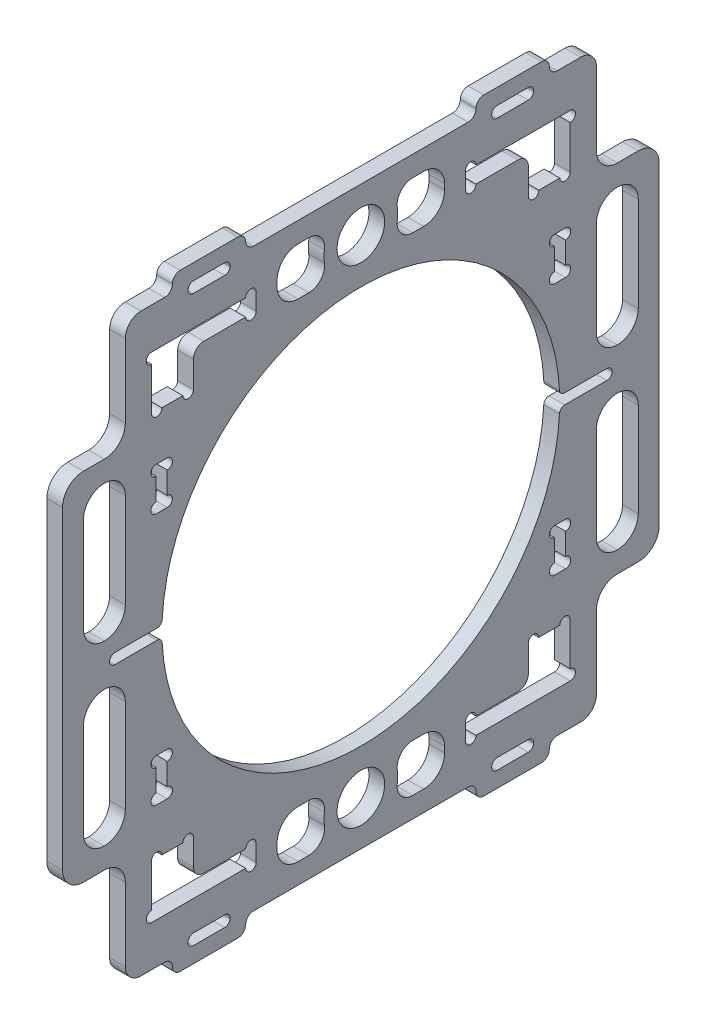
from build123d import *

# Parameters (mm, degrees)
SKETCH_1_W                = 90
SKETCH_1_H                = 110
SKETCH_1_R                = 38
EXTRUDE_1_DEPTH           = 3
FILLET_1_R                = 3
CUT_EXTRUDE_2_DEPTH       = 10
MIRROR_2_COPY_1_DEPTH     = 10
SKETCH_5_W                = 2.1
SKETCH_5_H                = 8.2
CUT_EXTRUDE_3_DEPTH       = 6
MIRROR_4_COPY_1_SKETCH_W  = 2.1
MIRROR_4_COPY_1_SKETCH_H  = 8.2
MIRROR_4_COPY_1_DEPTH     = 6
FILLET_2_R                = 2
SKETCH_6_W                = 32
SKETCH_6_H                = 9.1
CUT_EXTRUDE_4_DEPTH       = 10
FILLET_3_R                = 4
FILLET_3_OF_MIRROR_5_R    = 4
EXTRUDE_2_DEPTH           = 3
FILLET_5_R                = 4
SKETCH_10_R               = 7.05
SKETCH_10_R_2             = 4.55
EXTRUDE_3_DEPTH           = 3
FILLET_6_R                = 3
SKETCH_11_W               = 8
SKETCH_11_H               = 2.1
CUT_EXTRUDE_7_DEPTH       = 10
SKETCH_12_W               = 14
SKETCH_12_H               = 3
EXTRUDE_4_DEPTH           = 3
FILLET_7_R                = 1
FILLET_7_OF_MIRROR_12_R   = 1
MIRROR_13_DEPTH           = 3
MIRROR_13_2_OUTLINE_W     = 3
MIRROR_13_2_OUTLINE_H     = 14
MIRROR_13_2_DEPTH         = 3
FILLET_START              = -1
FILLET_8_DEPTH            = 5
FILLET_8_2_DEPTH          = 3
SKETCH_13_R               = 1
CUT_EXTRUDE_8_DEPTH       = 10
MIRROR_15_COPY_1_SKETCH_R = 1
MIRROR_15_COPY_1_DEPTH    = 10
SKETCH_14_W               = 17.279749577
SKETCH_14_H               = 8
EXTRUDE_5_DEPTH           = 3
FILLET_9_R                = 4
SKETCH_16_W               = 96
SKETCH_16_H               = 2
CUT_EXTRUDE_9_DEPTH       = 3
FILLET_10_R               = 1


with BuildPart() as part:
    # 草图1 → 凸台-拉伸1 (new body)
    with BuildSketch(Plane(origin=(0, 0, 0), x_dir=(0, 0, -1), z_dir=(1, 0, 0))):
        Rectangle(SKETCH_1_W, SKETCH_1_H)
        Circle(SKETCH_1_R, mode=Mode.SUBTRACT)
    extrude(amount=EXTRUDE_1_DEPTH)

    # 圆角1
    fillet_1_edges = [part.edges().sort_by_distance(p)[0] for p in [
        (1.5, 55, 45),
        (1.5, 55, -45),
        (1.5, -55, -45),
        (1.5, -55, 45),
    ]]
    fillet(fillet_1_edges, radius=FILLET_1_R)

    # 草图4 → 切除-拉伸2 (cut)
    with BuildSketch(Plane.ZY):
        Polygon((-32, -44), (-20, -44), (-20, -47.2), (-40, -47.2), (-40, -44), (-40, -37), (-32, -37), align=None)
    cut_extrude_2 = extrude(amount=-CUT_EXTRUDE_2_DEPTH, mode=Mode.SUBTRACT)

    # 镜向1: 切除-拉伸2 across plane
    add(cut_extrude_2.mirror(Plane.XY), mode=Mode.SUBTRACT)

    # 镜向2: 切除-拉伸2 across plane
    add(cut_extrude_2.mirror(Plane.ZX), mode=Mode.SUBTRACT)

    # 镜向2 copy 1 sketch → 镜向2 copy 1 (cut)
    with BuildSketch(Plane(origin=(0, 0, 0), x_dir=(0, 0, -1), z_dir=(-1, 0, 0))):
        Polygon((-32, -44), (-20, -44), (-20, -47.2), (-40, -47.2), (-40, -44), (-40, -37), (-32, -37), align=None)
    extrude(amount=-MIRROR_2_COPY_1_DEPTH, mode=Mode.SUBTRACT)

    # 草图5 → 切除-拉伸3 (cut)
    with BuildSketch(Plane.ZY):
        with Locations((-38.05, 24.1)):
            Rectangle(SKETCH_5_W, SKETCH_5_H)
    cut_extrude_3 = extrude(amount=-CUT_EXTRUDE_3_DEPTH, mode=Mode.SUBTRACT)

    # 镜向3: 切除-拉伸3 across plane
    add(cut_extrude_3.mirror(Plane.ZX), mode=Mode.SUBTRACT)

    # 镜向4: 切除-拉伸3 across plane
    add(cut_extrude_3.mirror(Plane.XY), mode=Mode.SUBTRACT)

    # 镜向4 copy 1 sketch → 镜向4 copy 1 (cut)
    with BuildSketch(Plane(origin=(0, 0, 0), x_dir=(0, 0, -1), z_dir=(-1, 0, 0))):
        with Locations((-38.05, 24.1)):
            Rectangle(MIRROR_4_COPY_1_SKETCH_W, MIRROR_4_COPY_1_SKETCH_H)
    extrude(amount=-MIRROR_4_COPY_1_DEPTH, mode=Mode.SUBTRACT)

    # 圆角2
    fillet_2_edges = [part.edges().sort_by_distance(p)[0] for p in [
        (1.5, 44, -32),
        (1.5, 44, 32),
        (1.5, -44, -32),
        (1.5, -44, 32),
    ]]
    fillet(fillet_2_edges, radius=FILLET_2_R)

    # 草图6 → 切除-拉伸4 (cut)
    with BuildSketch(Plane.ZY):
        with Locations((0, 46.55)):
            Rectangle(SKETCH_6_W, SKETCH_6_H)
    cut_extrude_4 = extrude(amount=-CUT_EXTRUDE_4_DEPTH, mode=Mode.SUBTRACT)

    # 圆角3
    fillet_3_edges = [part.edges().sort_by_distance(p)[0] for p in [
        (1.5, 51.1, 16),
        (1.5, 42, 16),
        (1.5, 42, -16),
        (1.5, 51.1, -16),
    ]]
    fillet(fillet_3_edges, radius=FILLET_3_R)

    # 镜向5: 切除-拉伸4 across plane
    add(cut_extrude_4.mirror(Plane.ZX), mode=Mode.SUBTRACT)

    # 圆角3 of 镜向5
    fillet_3_of_mirror_5_edges = [part.edges().sort_by_distance(p)[0] for p in [
        (1.5, -51.1, 16),
        (1.5, -42, 16),
        (1.5, -42, -16),
        (1.5, -51.1, -16),
    ]]
    fillet(fillet_3_of_mirror_5_edges, radius=FILLET_3_OF_MIRROR_5_R)

    # 草图9 → 凸台-拉伸2 (add)
    with BuildSketch(Plane.ZY):
        Polygon((53, 30), (53, -30), (45, -30), (45, -34), (57, -34), (57, 34), (45, 34), (45, 30), align=None)
    extrude_2 = extrude(amount=-EXTRUDE_2_DEPTH)

    # 镜向9: 凸台-拉伸2 across plane
    add(extrude_2.mirror(Plane.XY))

    # 圆角5
    fillet_5_edges = [part.edges().sort_by_distance(p)[0] for p in [
        (1.5, 34, 45),
        (1.5, 30, 45),
        (1.5, 30, 53),
        (1.5, 34, 57),
        (1.5, -34, 57),
        (1.5, -30, 53),
        (1.5, -30, 45),
        (1.5, -34, 45),
        (1.5, -34, -57),
        (1.5, 34, -57),
        (1.5, 30, -53),
        (1.5, -30, -53),
        (1.5, 30, -45),
        (1.5, -30, -45),
        (1.5, -34, -45),
        (1.5, 34, -45),
    ]]
    fillet(fillet_5_edges, radius=FILLET_5_R - 0.0001)  # a hair under: the kernel refuses the full size

    # 草图10 → 凸台-拉伸3 (add)
    with BuildSketch(Plane(origin=(3, 0, 0), x_dir=(0, 0, -1), z_dir=(1, 0, 0))):
        with Locations((0, 46.55)):
            Circle(SKETCH_10_R)
        with Locations((0, 46.55)):
            Circle(SKETCH_10_R_2, mode=Mode.SUBTRACT)
    extrude_3 = extrude(amount=-EXTRUDE_3_DEPTH)

    # 镜向11: 凸台-拉伸3 across plane
    add(extrude_3.mirror(Plane.ZX))

    # 圆角6
    fillet_6_edges = [part.edges().sort_by_distance(p)[0] for p in [
        (1.5, 51.1, -5.385164807),
        (1.5, 51.1, 5.385164807),
        (1.5, 42, -5.385164807),
        (1.5, 42, 5.385164807),
        (1.5, -42, 5.385164807),
        (1.5, -42, -5.385164807),
        (1.5, -51.1, 5.385164807),
        (1.5, -51.1, -5.385164807),
    ]]
    fillet(fillet_6_edges, radius=FILLET_6_R)

    # 草图11 → 切除-拉伸7 (cut)
    with BuildSketch(Plane(origin=(3, 0, 0), x_dir=(0, 0, -1), z_dir=(1, 0, 0))):
        with Locations((-29, -53.95)):
            Rectangle(SKETCH_11_W, SKETCH_11_H)
    cut_extrude_7 = extrude(amount=-CUT_EXTRUDE_7_DEPTH, mode=Mode.SUBTRACT)

    # 草图12 → 凸台-拉伸4 (add)
    with BuildSketch(Plane(origin=(3, 0, 0), x_dir=(0, 0, -1), z_dir=(1, 0, 0))):
        with Locations((-29, -56.5)):
            Rectangle(SKETCH_12_W, SKETCH_12_H)
    extrude_4 = extrude(amount=-EXTRUDE_4_DEPTH)

    # 圆角7
    fillet_7_edges = [part.edges().sort_by_distance(p)[0] for p in [
        (1.5, -55, 25),
        (1.5, -55, 33),
        (1.5, -52.9, 33),
        (1.5, -52.9, 25),
    ]]
    fillet(fillet_7_edges, radius=FILLET_7_R)

    # 镜向12: 切除-拉伸7, 凸台-拉伸4 across plane
    add(cut_extrude_7.mirror(Plane.ZX), mode=Mode.SUBTRACT)
    add(extrude_4.mirror(Plane.ZX))

    # 圆角7 of 镜向12
    fillet_7_of_mirror_12_edges = [part.edges().sort_by_distance(p)[0] for p in [
        (1.5, 55, 25),
        (1.5, 55, 33),
        (1.5, 52.9, 33),
        (1.5, 52.9, 25),
    ]]
    fillet(fillet_7_of_mirror_12_edges, radius=FILLET_7_OF_MIRROR_12_R)

    # 镜向13: read off the stored shape, not the designer's step
    # 镜向13 outline → 镜向13 (cut)
    with BuildSketch(Plane.YZ):
        with BuildLine():
            Line((-52.9, -32), (-52.9, -26))
            ThreePointArc((-52.9, -26), (-53.192893219, -25.292893219), (-53.9, -25))
            Line((-53.9, -25), (-54, -25))
            ThreePointArc((-54, -25), (-54.707106781, -25.292893219), (-55, -26))
            Line((-55, -26), (-55, -32))
            ThreePointArc((-55, -32), (-54.707106781, -32.707106781), (-54, -33))
            Line((-54, -33), (-53.9, -33))
            ThreePointArc((-53.9, -33), (-53.192893219, -32.707106781), (-52.9, -32))
        make_face()
        with BuildLine():
            ThreePointArc((53.9, -25), (53.192893219, -25.292893219), (52.9, -26))
            Line((52.9, -26), (52.9, -32))
            ThreePointArc((52.9, -32), (53.192893219, -32.707106781), (53.9, -33))
            Line((53.9, -33), (54, -33))
            ThreePointArc((54, -33), (54.707106781, -32.707106781), (55, -32))
            Line((55, -32), (55, -26))
            ThreePointArc((55, -26), (54.707106781, -25.292893219), (54, -25))
            Line((54, -25), (53.9, -25))
        make_face()
    extrude(amount=MIRROR_13_DEPTH, mode=Mode.SUBTRACT)

    # Mirror 13 2 outline → Mirror 13 2 (add)
    with BuildSketch(Plane.YZ):
        with Locations((-56.5, -29)):
            Rectangle(MIRROR_13_2_OUTLINE_W, MIRROR_13_2_OUTLINE_H)
        with Locations((56.5, -29)):
            Rectangle(MIRROR_13_2_OUTLINE_W, MIRROR_13_2_OUTLINE_H)
    extrude(amount=MIRROR_13_2_DEPTH)

    # 圆角8: read off the stored shape, not the designer's step
    # 圆角8 outline → 圆角8 (cut)
    with BuildSketch(Plane.YZ.offset(FILLET_START)):
        with BuildLine():
            ThreePointArc((56.5, 36), (57.560660172, 35.560660172), (58, 34.5))
            Line((58, 34.5), (58, 36))
            Line((58, 36), (56.5, 36))
        make_face()
        with BuildLine():
            Line((58, -36), (58, -34.5))
            ThreePointArc((58, -34.5), (57.560660172, -35.560660172), (56.5, -36))
            Line((56.5, -36), (58, -36))
        make_face()
        with BuildLine():
            Line((58, -22), (56.5, -22))
            ThreePointArc((56.5, -22), (57.560660172, -22.439339828), (58, -23.5))
            Line((58, -23.5), (58, -22))
        make_face()
        with BuildLine():
            Line((58, 22), (58, 23.5))
            ThreePointArc((58, 23.5), (57.560660172, 22.439339828), (56.5, 22))
            Line((56.5, 22), (58, 22))
        make_face()
        with BuildLine():
            ThreePointArc((-56.5, -36), (-57.560660172, -35.560660172), (-58, -34.5))
            Line((-58, -34.5), (-58, -36))
            Line((-58, -36), (-56.5, -36))
        make_face()
        with BuildLine():
            Line((-58, 36), (-58, 34.5))
            ThreePointArc((-58, 34.5), (-57.560660172, 35.560660172), (-56.5, 36))
            Line((-56.5, 36), (-58, 36))
        make_face()
        with BuildLine():
            Line((-58, 22), (-56.5, 22))
            ThreePointArc((-56.5, 22), (-57.560660172, 22.439339828), (-58, 23.5))
            Line((-58, 23.5), (-58, 22))
        make_face()
        with BuildLine():
            Line((-58, -22), (-58, -23.5))
            ThreePointArc((-58, -23.5), (-57.560660172, -22.439339828), (-56.5, -22))
            Line((-56.5, -22), (-58, -22))
        make_face()
    extrude(amount=FILLET_8_DEPTH, mode=Mode.SUBTRACT)

    # Fillet 8 2 outline → Fillet 8 2 (add)
    with BuildSketch(Plane.YZ):
        with BuildLine():
            Line((55, 36), (56.5, 36))
            ThreePointArc((56.5, 36), (55.439339828, 36.439339828), (55, 37.5))
            Line((55, 37.5), (55, 36))
        make_face()
        with BuildLine():
            ThreePointArc((55, -37.5), (55.439339828, -36.439339828), (56.5, -36))
            Line((56.5, -36), (55, -36))
            Line((55, -36), (55, -37.5))
        make_face()
        with BuildLine():
            ThreePointArc((56.5, -22), (55.439339828, -21.560660172), (55, -20.5))
            Line((55, -20.5), (55, -22))
            Line((55, -22), (56.5, -22))
        make_face()
        with BuildLine():
            ThreePointArc((55, 20.5), (55.439339828, 21.560660172), (56.5, 22))
            Line((56.5, 22), (55, 22))
            Line((55, 22), (55, 20.5))
        make_face()
        with BuildLine():
            Line((-55, -36), (-56.5, -36))
            ThreePointArc((-56.5, -36), (-55.439339828, -36.439339828), (-55, -37.5))
            Line((-55, -37.5), (-55, -36))
        make_face()
        with BuildLine():
            ThreePointArc((-55, 37.5), (-55.439339828, 36.439339828), (-56.5, 36))
            Line((-56.5, 36), (-55, 36))
            Line((-55, 36), (-55, 37.5))
        make_face()
        with BuildLine():
            ThreePointArc((-56.5, 22), (-55.439339828, 21.560660172), (-55, 20.5))
            Line((-55, 20.5), (-55, 22))
            Line((-55, 22), (-56.5, 22))
        make_face()
        with BuildLine():
            ThreePointArc((-55, -20.5), (-55.439339828, -21.560660172), (-56.5, -22))
            Line((-56.5, -22), (-55, -22))
            Line((-55, -22), (-55, -20.5))
        make_face()
    extrude(amount=FILLET_8_2_DEPTH)

    # 草图13 → 切除-拉伸8 (cut)
    with BuildSketch(Plane(origin=(3, 0, 0), x_dir=(0, 0, -1), z_dir=(1, 0, 0))):
        with Locations((-40, 46.2)):
            Circle(SKETCH_13_R)
        with Locations((-21, 47.2)):
            Circle(SKETCH_13_R)
        with Locations((-21, 44)):
            Circle(SKETCH_13_R)
        with Locations((-39, 37)):
            Circle(SKETCH_13_R)
        with Locations((-33, 37)):
            Circle(SKETCH_13_R)
        with Locations((-37, 27.2)):
            Circle(SKETCH_13_R)
        with Locations((-39.1, 27.2)):
            Circle(SKETCH_13_R)
        with Locations((-39.1, 21)):
            Circle(SKETCH_13_R)
        with Locations((-37, 21)):
            Circle(SKETCH_13_R)
    cut_extrude_8 = extrude(amount=-CUT_EXTRUDE_8_DEPTH, mode=Mode.SUBTRACT)

    # 镜向14: 切除-拉伸8 across plane
    add(cut_extrude_8.mirror(Plane.XY), mode=Mode.SUBTRACT)

    # 镜向15: 切除-拉伸8 across plane
    add(cut_extrude_8.mirror(Plane.ZX), mode=Mode.SUBTRACT)

    # 镜向15 copy 1 sketch → 镜向15 copy 1 (cut)
    with BuildSketch(Plane(origin=(3, 0, 0), x_dir=(0, 0, 1), z_dir=(1, 0, 0))):
        with Locations((-40, 46.2)):
            Circle(MIRROR_15_COPY_1_SKETCH_R)
        with Locations((-21, 47.2)):
            Circle(MIRROR_15_COPY_1_SKETCH_R)
        with Locations((-21, 44)):
            Circle(MIRROR_15_COPY_1_SKETCH_R)
        with Locations((-39, 37)):
            Circle(MIRROR_15_COPY_1_SKETCH_R)
        with Locations((-33, 37)):
            Circle(MIRROR_15_COPY_1_SKETCH_R)
        with Locations((-37, 27.2)):
            Circle(MIRROR_15_COPY_1_SKETCH_R)
        with Locations((-39.1, 27.2)):
            Circle(MIRROR_15_COPY_1_SKETCH_R)
        with Locations((-39.1, 21)):
            Circle(MIRROR_15_COPY_1_SKETCH_R)
        with Locations((-37, 21)):
            Circle(MIRROR_15_COPY_1_SKETCH_R)
    extrude(amount=-MIRROR_15_COPY_1_DEPTH, mode=Mode.SUBTRACT)

    # 草图14 → 凸台-拉伸5 (add)
    with BuildSketch(Plane.ZY):
        with Locations((-48.360125212, -0.095963338)):
            Rectangle(SKETCH_14_W, SKETCH_14_H)
    extrude_5 = extrude(amount=-EXTRUDE_5_DEPTH)

    # 镜向17: 凸台-拉伸5 across plane
    add(extrude_5.mirror(Plane.XY))

    # 圆角9
    fillet_9_edges = [part.edges().sort_by_distance(p)[0] for p in [
        (1.5, -4.095963338, -45),
        (1.5, -4.095963338, -53),
        (1.5, 3.904036662, -45),
        (1.5, 3.904036662, -53),
        (1.5, 3.904036662, 53),
        (1.5, 3.904036662, 45),
        (1.5, -4.095963338, 45),
        (1.5, -4.095963338, 53),
    ]]
    fillet(fillet_9_edges, radius=FILLET_9_R - 0.0001)  # a hair under: the kernel refuses the full size

    # 草图16 → 切除-拉伸9 (cut)
    with BuildSketch(Plane.ZY):
        Rectangle(SKETCH_16_W, SKETCH_16_H)
    extrude(amount=-CUT_EXTRUDE_9_DEPTH, mode=Mode.SUBTRACT)

    # 圆角10
    fillet_10_edges = [part.edges().sort_by_distance(p)[0] for p in [
        (1.5, -1, 48),
        (1.5, 1, 48),
        (1.5, 1, -37.986839826),
        (1.5, 1, 37.986839826),
        (1.5, -1, 37.986839826),
        (1.5, -1, -37.986839826),
        (1.5, 1, -48),
        (1.5, -1, -48),
    ]]
    fillet(fillet_10_edges, radius=FILLET_10_R - 0.0001)  # a hair under: the kernel refuses the full size


solid = part.part
